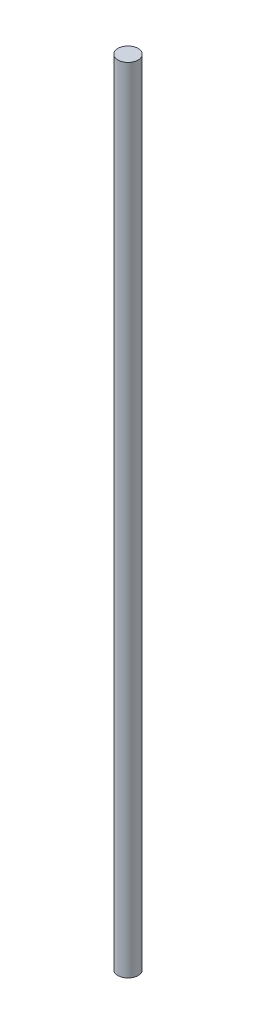
from build123d import *

# Parameters (mm, degrees)
SKETCH1_R           = 4.7625
BOSS_EXTRUDE1_DEPTH = 374.65


with BuildPart() as part:
    # Sketch1 → Boss-Extrude1 (new body)
    with BuildSketch(Plane(origin=(0, 0, 0), x_dir=(1, 0, 0), z_dir=(0, 1, 0))):
        Circle(SKETCH1_R)
    extrude(amount=BOSS_EXTRUDE1_DEPTH)


solid = part.part
